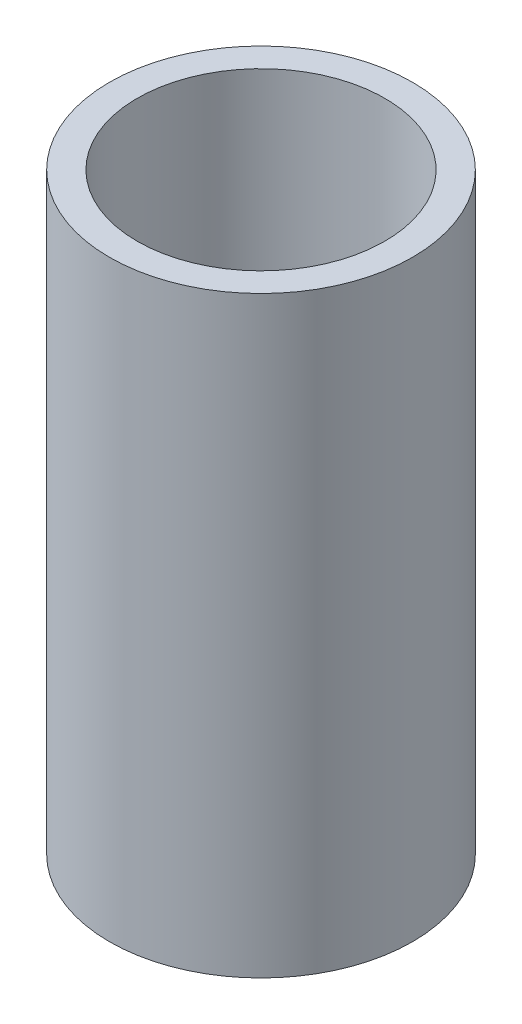
from build123d import *

# Parameters (mm, degrees)
SKETCH1_R           = 20
BOSS_EXTRUDE1_DEPTH = 78.216664852
SKETCH2_R           = 16.33821631
CUT_EXTRUDE1_DEPTH  = 84.173593529


with BuildPart() as part:
    # Sketch1 → Boss-Extrude1 (new body)
    with BuildSketch(Plane(origin=(0, 0, 0), x_dir=(1, 0, 0), z_dir=(0, 1, 0))):
        Circle(SKETCH1_R)
    extrude(amount=BOSS_EXTRUDE1_DEPTH)

    # Sketch2 → Cut-Extrude1 (cut, through all)
    with BuildSketch(Plane(origin=(0, 0, 0), x_dir=(1, 0, 0), z_dir=(0, 1, 0))):
        Circle(SKETCH2_R)
    extrude(amount=CUT_EXTRUDE1_DEPTH, mode=Mode.SUBTRACT)


solid = part.part
